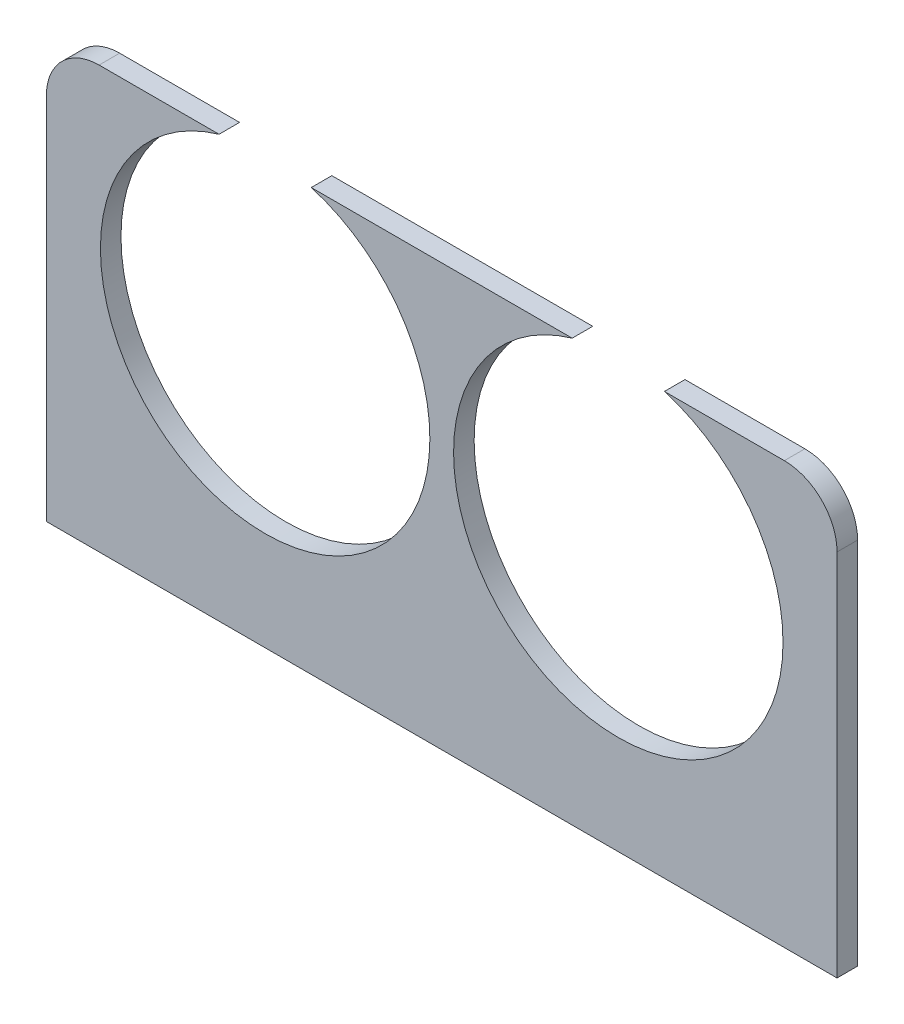
from build123d import *

# Parameters (mm, degrees)
BOSS_EXTRUDE1_DEPTH = 0.78
FILLET1_R           = 2


with BuildPart() as part:
    # Sketch1 → Boss-Extrude1 (new body)
    with BuildSketch(Plane.XY):
        with BuildLine():
            Line((-15, 8), (-15, -8))
            Line((-15, -8), (15, -8))
            Line((15, -8), (15, 8))
            Line((15, 8), (8.45, 8))
            ThreePointArc((8.45, 8), (11.7, 5.75), (12.95, 2))
            ThreePointArc((12.95, 2), (2.95, -3), (4.95, 8))
            Line((4.95, 8), (-4.95, 8))
            ThreePointArc((-4.95, 8), (-1.7, 5.75), (-0.45, 2))
            ThreePointArc((-0.45, 2), (-10.45, -3), (-8.45, 8))
            Line((-8.45, 8), (-15, 8))
        make_face()
    extrude(amount=BOSS_EXTRUDE1_DEPTH)

    # Fillet1
    fillet1_edges = [part.edges().sort_by_distance(p)[0] for p in [
        (15, 8, 0.39),
        (-15, 8, 0.39),
    ]]
    fillet(fillet1_edges, radius=FILLET1_R)


solid = part.part
